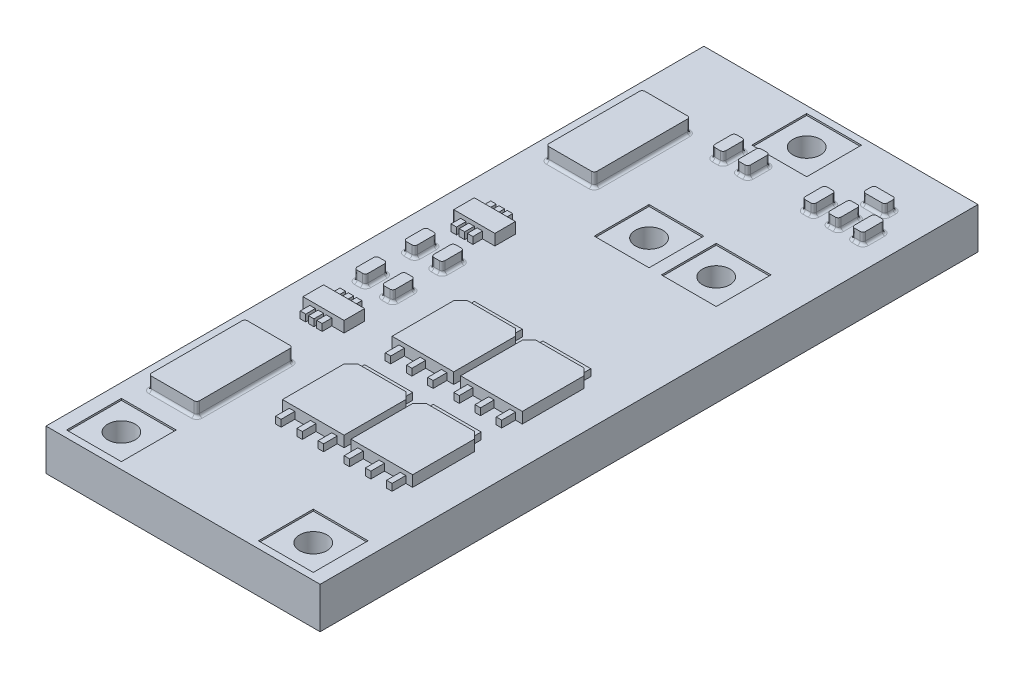
from build123d import *

# Parameters (mm, degrees)
CROQUIS1_W              = 20
CROQUIS1_H              = 48
SALIENTE_EXTRUIR1_DEPTH = 3
CROQUIS2_W              = 0.8
CROQUIS2_H              = 1.6
CROQUIS2_W_2            = 1.6
CROQUIS2_H_2            = 0.8
SALIENTE_EXTRUIR2_DEPTH = 0.8
REDONDEO1_R             = 0.2
CROQUIS3_W              = 3.5
CROQUIS3_H              = 7
SALIENTE_EXTRUIR3_DEPTH = 1
REDONDEO2_R             = 0.2
SALIENTE_EXTRUIR4_DEPTH = 0.8
CROQUIS5_W              = 0.4
CROQUIS5_H              = 0.998570142
CROQUIS5_W_2            = 3.5
CROQUIS5_H_2            = 0.5
CROQUIS5_H_3            = 1
SALIENTE_EXTRUIR5_DEPTH = 0.5
MATRIZL1_COUNT          = 2
MATRIZL1_PITCH          = 5
MATRIZL1_COUNT_DIR2     = 2
MATRIZL1_PITCH_DIR2     = 8
CROQUIS6_W              = 4
CROQUIS6_H              = 4
CROQUIS6_R              = 1
CORTAR_EXTRUIR1_DEPTH   = 0.125
CROQUIS6_2_R            = 1
CORTAR_EXTRUIR2_DEPTH   = 3
CROQUIS8_W              = 3
CROQUIS8_H              = 1.5
SALIENTE_EXTRUIR6_DEPTH = 0.8
CROQUIS9_W              = 0.4
CROQUIS9_H              = 0.7
SALIENTE_EXTRUIR7_DEPTH = 0.5
MATRIZL2_COUNT          = 2
MATRIZL2_PITCH          = 11
CROQUIS10_W             = 4
CROQUIS10_H             = 4
CROQUIS10_R             = 1
CORTAR_EXTRUIR3_DEPTH   = 0.125
CROQUIS10_3_R           = 1
CORTAR_EXTRUIR4_DEPTH   = 3
CROQUIS11_W             = 4
CROQUIS11_H             = 4
CROQUIS11_R             = 1
CORTAR_EXTRUIR5_DEPTH   = 0.125
CROQUIS11_2_R           = 1
CORTAR_EXTRUIR7_DEPTH   = 3
MATRIZL3_COUNT          = 2
MATRIZL3_PITCH          = 4.9


with BuildPart() as part:
    # Croquis1 → Saliente-Extruir1 (new body)
    with BuildSketch(Plane(origin=(0, 0, 0), x_dir=(1, 0, 0), z_dir=(0, 1, 0))):
        Rectangle(CROQUIS1_W, CROQUIS1_H)
    extrude(amount=SALIENTE_EXTRUIR1_DEPTH)

    # Croquis2 → Saliente-Extruir2 (add)
    with BuildSketch(Plane(origin=(0, 3, 0), x_dir=(1, 0, 0), z_dir=(0, 1, 0))):
        with Locations((-5.5, 0.8)):
            Rectangle(CROQUIS2_W, CROQUIS2_H)
        with Locations((-7.5, 0.8)):
            Rectangle(CROQUIS2_W, CROQUIS2_H)
        with Locations((-7.5, -2.8)):
            Rectangle(CROQUIS2_W, CROQUIS2_H)
        with Locations((-5.5, -2.8)):
            Rectangle(CROQUIS2_W, CROQUIS2_H)
        with Locations((-2.2, 18)):
            Rectangle(CROQUIS2_W, CROQUIS2_H)
        with Locations((-0.4, 18)):
            Rectangle(CROQUIS2_W, CROQUIS2_H)
        with Locations((4.4, 18)):
            Rectangle(CROQUIS2_W, CROQUIS2_H)
        with Locations((6.2, 18)):
            Rectangle(CROQUIS2_W, CROQUIS2_H)
        with Locations((6.6, 20.2)):
            Rectangle(CROQUIS2_W_2, CROQUIS2_H_2)
        with Locations((8, 18)):
            Rectangle(CROQUIS2_W, CROQUIS2_H)
    extrude(amount=SALIENTE_EXTRUIR2_DEPTH)

    # Redondeo1
    redondeo1_edges = [part.edges().sort_by_distance(p)[0] for p in [
        (-0.4, 3, -17.2),
        (-5.9, 3, 2.8),
        (-7.9, 3, 2.8),
        (-7.9, 3, -0.8),
        (-5.5, 3, -1.6),
        (8.4, 3, -18),
        (7.4, 3, -20.2),
        (5.8, 3, -18),
        (4, 3, -18),
        (-2.6, 3, -18),
        (0, 3, -18),
        (-0.8, 3, -18),
        (-5.5, 3, 3.6),
        (-5.5, 3, 2),
        (-7.5, 3, 3.6),
        (-7.5, 3, 2),
        (-7.5, 3, 0),
        (-7.5, 3, -1.6),
        (-5.9, 3, -0.8),
        (-5.1, 3, -0.8),
        (8, 3, -18.8),
        (8, 3, -17.2),
        (6.6, 3, -20.6),
        (6.6, 3, -19.8),
        (6.2, 3, -17.2),
        (6.2, 3, -18.8),
        (4.4, 3, -17.2),
        (4.4, 3, -18.8),
        (-2.2, 3, -17.2),
        (-2.2, 3, -18.8),
        (-0.4, 3, -18.8),
        (-0.8, 3.4, -18.8),
        (0, 3.4, -18.8),
        (-5.1, 3, 2.8),
        (-5.9, 3.4, 2),
        (-5.1, 3.4, 2),
        (-5.9, 3.4, 3.6),
        (-5.1, 3.4, 3.6),
        (-7.1, 3, 2.8),
        (-7.1, 3.4, 2),
        (-7.1, 3.4, 3.6),
        (-7.9, 3.4, 2),
        (-7.9, 3.4, 3.6),
        (-7.1, 3, -0.8),
        (-7.1, 3.4, -1.6),
        (-7.1, 3.4, 0),
        (-7.9, 3.4, -1.6),
        (-7.9, 3.4, 0),
        (-5.9, 3.4, 0),
        (-5.5, 3, 0),
        (-5.9, 3.4, -1.6),
        (-5.1, 3.4, 0),
        (-5.1, 3.4, -1.6),
        (7.6, 3, -18),
        (7.6, 3.4, -18.8),
        (7.6, 3.4, -17.2),
        (8.4, 3.4, -17.2),
        (8.4, 3.4, -18.8),
        (5.8, 3, -20.2),
        (5.8, 3.4, -19.8),
        (5.8, 3.4, -20.6),
        (7.4, 3.4, -20.6),
        (7.4, 3.4, -19.8),
        (5.8, 3.4, -18.8),
        (6.6, 3, -18),
        (6.6, 3.4, -18.8),
        (5.8, 3.4, -17.2),
        (6.6, 3.4, -17.2),
        (4.8, 3, -18),
        (4, 3.4, -18.8),
        (4.8, 3.4, -18.8),
        (4, 3.4, -17.2),
        (4.8, 3.4, -17.2),
        (-1.8, 3, -18),
        (0, 3.4, -17.2),
        (-0.8, 3.4, -17.2),
        (-1.8, 3.4, -17.2),
        (-2.6, 3.4, -17.2),
        (-2.6, 3.4, -18.8),
        (-1.8, 3.4, -18.8),
    ]]
    fillet(redondeo1_edges, radius=REDONDEO1_R)

    # Croquis3 → Saliente-Extruir3 (add)
    with BuildSketch(Plane(origin=(0, 3, 0), x_dir=(1, 0, 0), z_dir=(0, 1, 0))):
        with Locations((-6.75, 14.5)):
            Rectangle(CROQUIS3_W, CROQUIS3_H)
        with Locations((-6.75, -14.5)):
            Rectangle(CROQUIS3_W, CROQUIS3_H)
    extrude(amount=SALIENTE_EXTRUIR3_DEPTH)

    # Redondeo2
    redondeo2_edges = [part.edges().sort_by_distance(p)[0] for p in [
        (-5, 3, -14.5),
        (-5, 3.5, -11),
        (-6.75, 3, -18),
        (-5, 3.5, -18),
        (-8.5, 3, -14.5),
        (-8.5, 3.5, -18),
        (-6.75, 3, -11),
        (-8.5, 3.5, -11),
        (-5, 3, 14.5),
        (-5, 3.5, 18),
        (-6.75, 3, 11),
        (-5, 3.5, 11),
        (-8.5, 3, 14.5),
        (-8.5, 3.5, 11),
        (-6.75, 3, 18),
        (-8.5, 3.5, 18),
    ]]
    fillet(redondeo2_edges, radius=REDONDEO2_R)

    # Croquis4 → Saliente-Extruir4 (add)
    with BuildSketch(Plane(origin=(0, 3, 0), x_dir=(1, 0, 0), z_dir=(0, 1, 0))):
        Polygon((1.75, -1.5), (2.25, -2), (2.25, -6.5), (-2.25, -6.5), (-2.25, -2), (-1.75, -1.5), align=None)
    saliente_extruir4 = extrude(amount=SALIENTE_EXTRUIR4_DEPTH)

    # Croquis5 → Saliente-Extruir5 (add)
    with BuildSketch(Plane(origin=(0, 3, 0), x_dir=(1, 0, 0), z_dir=(0, 1, 0))):
        with Locations((-1.55, -6.999285071)):
            Rectangle(CROQUIS5_W, CROQUIS5_H)
        with Locations((0, -1.25)):
            Rectangle(CROQUIS5_W_2, CROQUIS5_H_2)
        with Locations((-0.002702596, -6.999285071)):
            Rectangle(CROQUIS5_W, CROQUIS5_H)
        with Locations((1.55, -7)):
            Rectangle(CROQUIS5_W, CROQUIS5_H_3)
    saliente_extruir5 = extrude(amount=SALIENTE_EXTRUIR5_DEPTH)

    # MatrizL1: Saliente-Extruir4, Saliente-Extruir5 2 × 2
    with Locations(*[(i * MATRIZL1_PITCH, 0, j * MATRIZL1_PITCH_DIR2) for i in range(MATRIZL1_COUNT) for j in range(MATRIZL1_COUNT_DIR2) if (i, j) != (0, 0)]):
        add(saliente_extruir4)
        add(saliente_extruir5)

    # Croquis6 → Cortar-Extruir1 (cut)
    # profile 1 of 2: a face of its own
    with BuildSketch(Plane(origin=(0, 3, 0), x_dir=(1, 0, 0), z_dir=(0, 1, 0))):
        with Locations((-7, -21.5)):
            Rectangle(CROQUIS6_W, CROQUIS6_H)
        with Locations(Location((-7, -21.5, 0), (0, 0, 270))):
            Circle(CROQUIS6_R, mode=Mode.SUBTRACT)
    # profile 2 of 2: a face of its own
    with BuildSketch(Plane(origin=(0, 3, 0), x_dir=(1, 0, 0), z_dir=(0, 1, 0))):
        with Locations((7, -21.5)):
            Rectangle(CROQUIS6_W, CROQUIS6_H)
        with Locations(Location((7, -21.5, 0), (0, 0, 270))):
            Circle(CROQUIS6_R, mode=Mode.SUBTRACT)
    extrude(amount=-CORTAR_EXTRUIR1_DEPTH, mode=Mode.SUBTRACT)

    # Croquis6<2> → Cortar-Extruir2 (cut)
    with BuildSketch(Plane(origin=(0, 3, 0), x_dir=(1, 0, 0), z_dir=(0, 1, 0))):
        with Locations(Location((-7, -21.5, 0), (0, 0, 270))):
            Circle(CROQUIS6_2_R)
        with Locations(Location((7, -21.5, 0), (0, 0, 270))):
            Circle(CROQUIS6_2_R)
    extrude(amount=-CORTAR_EXTRUIR2_DEPTH, mode=Mode.SUBTRACT)

    # Croquis8 → Saliente-Extruir6 (add)
    with BuildSketch(Plane(origin=(0, 3, 0), x_dir=(1, 0, 0), z_dir=(0, 1, 0))):
        with Locations((-6.5, -6.5)):
            Rectangle(CROQUIS8_W, CROQUIS8_H)
        with Locations((-6.5, 4.5)):
            Rectangle(CROQUIS8_W, CROQUIS8_H)
    extrude(amount=SALIENTE_EXTRUIR6_DEPTH)

    # Croquis9 → Saliente-Extruir7 (add)
    with BuildSketch(Plane(origin=(0, 3, 0), x_dir=(1, 0, 0), z_dir=(0, 1, 0))):
        with Locations((-7.3, -5.4)):
            Rectangle(CROQUIS9_W, CROQUIS9_H)
        with Locations((-6.7, -5.4)):
            Rectangle(CROQUIS9_W, CROQUIS9_H)
        with Locations((-6.1, -5.4)):
            Rectangle(CROQUIS9_W, CROQUIS9_H)
        with Locations((-6.1, -7.6)):
            Rectangle(CROQUIS9_W, CROQUIS9_H)
        with Locations((-6.7, -7.6)):
            Rectangle(CROQUIS9_W, CROQUIS9_H)
        with Locations((-7.3, -7.6)):
            Rectangle(CROQUIS9_W, CROQUIS9_H)
    saliente_extruir7 = extrude(amount=SALIENTE_EXTRUIR7_DEPTH)

    # MatrizL2: Saliente-Extruir7 ×2
    with Locations(*[(0, 0, -i * MATRIZL2_PITCH) for i in range(1, MATRIZL2_COUNT)]):
        add(saliente_extruir7)

    # Croquis10 → Cortar-Extruir3 (cut)
    with BuildSketch(Plane(origin=(0, 3, 0), x_dir=(1, 0, 0), z_dir=(0, 1, 0))):
        with Locations((0, 21.5)):
            Rectangle(CROQUIS10_W, CROQUIS10_H)
        with Locations(Location((0, 21.5, 0), (0, 0, 270))):
            Circle(CROQUIS10_R, mode=Mode.SUBTRACT)
    extrude(amount=-CORTAR_EXTRUIR3_DEPTH, mode=Mode.SUBTRACT)

    # Croquis10<3> → Cortar-Extruir4 (cut)
    with BuildSketch(Plane(origin=(0, 3, 0), x_dir=(1, 0, 0), z_dir=(0, 1, 0))):
        with Locations(Location((0, 21.5, 0), (0, 0, 270))):
            Circle(CROQUIS10_3_R)
    extrude(amount=-CORTAR_EXTRUIR4_DEPTH, mode=Mode.SUBTRACT)

    # Croquis11 → Cortar-Extruir5 (cut)
    with BuildSketch(Plane(origin=(0, 3, 0), x_dir=(1, 0, 0), z_dir=(0, 1, 0))):
        with Locations((0, 10)):
            Rectangle(CROQUIS11_W, CROQUIS11_H)
        with Locations(Location((0, 10, 0), (0, 0, 270))):
            Circle(CROQUIS11_R, mode=Mode.SUBTRACT)
    cortar_extruir5 = extrude(amount=-CORTAR_EXTRUIR5_DEPTH, mode=Mode.SUBTRACT)

    # Croquis11<2> → Cortar-Extruir7 (cut)
    with BuildSketch(Plane(origin=(0, 3, 0), x_dir=(1, 0, 0), z_dir=(0, 1, 0))):
        with Locations(Location((0, 10, 0), (0, 0, 270))):
            Circle(CROQUIS11_2_R)
    cortar_extruir7 = extrude(amount=-CORTAR_EXTRUIR7_DEPTH, mode=Mode.SUBTRACT)

    # MatrizL3: Cortar-Extruir5, Cortar-Extruir7 ×2
    with Locations(*[(i * MATRIZL3_PITCH, 0, 0) for i in range(1, MATRIZL3_COUNT)]):
        add(cortar_extruir5, mode=Mode.SUBTRACT)
        add(cortar_extruir7, mode=Mode.SUBTRACT)


solid = part.part
